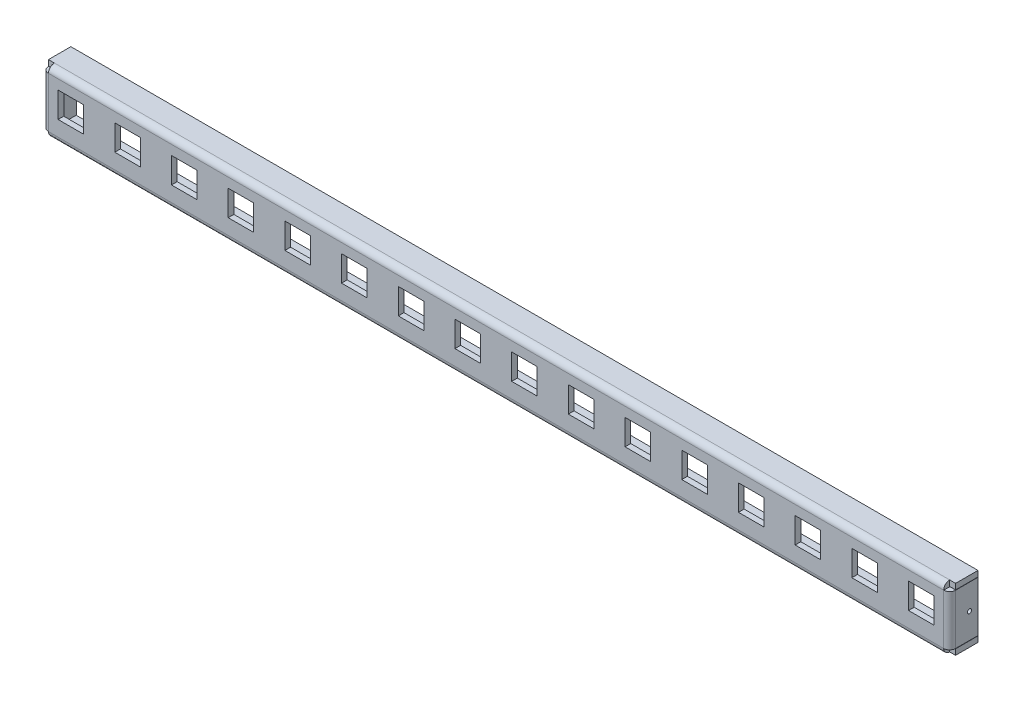
from build123d import *

# Parameters (mm, degrees)
SKETCH_1_W                         = 320
SKETCH_1_H                         = 22
SM_BASE_FLANGE_1_DEPTH             = 2
SM_EDGE_FLANGE_1_STRIP_W           = 8.2
SM_EDGE_FLANGE_1_STRIP_H           = 2
SM_EDGE_FLANGE_1_STRIP_CUT_DEPTH   = 320
SM_EDGE_FLANGE_1_STRIP_2_W         = 8.2
SM_EDGE_FLANGE_1_STRIP_2_H         = 2
SM_EDGE_FLANGE_1_STRIP_CUT_2_DEPTH = 320
SM_EDGE_FLANGE_1_DEPTH             = 320
SM_EDGE_FLANGE_1_BEND_DEPTH        = 320
SM_START                           = -11
SM_EDGE_FLANGE_2_DEPTH             = 22
SM_EDGE_FLANGE_2_2_DEPTH           = 2.1
SM_START_2                         = 8.9
SM_EDGE_FLANGE_2_3_DEPTH           = 2.1
SM_START_3                         = -8.9
SM_EDGE_FLANGE_2_4_DEPTH           = 17.8
SKETCH_18_W                        = 9
SKETCH_18_H                        = 9
CUT_EXTRUDE_1_DEPTH                = 10
PATTERN_LINEAR_1_COUNT             = 20
PATTERN_LINEAR_1_PITCH             = 20
CUT_EXTRUDE_2_DEPTH                = 321.345126387
CUT_EXTRUDE_2_DEPTH_BACK           = 321.345126387
SKETCH_19_R                        = 0.75


# Read off the part's stored shape, not the designer's step: 边线-法兰2
# Sheet-metal steps are written as plain solids
with BuildPart() as part:
    # Sketch 1 → 基体-法兰1 (new body)
    with BuildSketch(Plane.XY):
        Rectangle(SKETCH_1_W, SKETCH_1_H)
    extrude(amount=-SM_BASE_FLANGE_1_DEPTH)

    # 边线-法兰1 strip (across the edge) → 边线-法兰1 strip cut (cut)
    with BuildSketch(Plane(origin=(160, -11, -2), x_dir=(0, 1, 0), z_dir=(-1, 0, 0))):
        with Locations((-2, -1)):
            Rectangle(SM_EDGE_FLANGE_1_STRIP_W, SM_EDGE_FLANGE_1_STRIP_H)
    extrude(amount=SM_EDGE_FLANGE_1_STRIP_CUT_DEPTH, mode=Mode.SUBTRACT)

    # 边线-法兰1 strip 2 (across the edge) → 边线-法兰1 strip cut 2 (cut)
    with BuildSketch(Plane(origin=(-160, 11, -2), x_dir=(0, -1, 0), z_dir=(1, 0, 0))):
        with Locations((-2, -1)):
            Rectangle(SM_EDGE_FLANGE_1_STRIP_2_W, SM_EDGE_FLANGE_1_STRIP_2_H)
    extrude(amount=SM_EDGE_FLANGE_1_STRIP_CUT_2_DEPTH, mode=Mode.SUBTRACT)

    # 边线-法兰1 section (across the edge) → 边线-法兰1 (add)
    with BuildSketch(Plane(origin=(160, -11, -2), x_dir=(0, 1, 0), z_dir=(-1, 0, 0))):
        with BuildLine():
            Line((0, 0.1), (0, 8))
            Line((0, 8), (2, 8))
            Line((2, 8), (2, 0.1))
            ThreePointArc((2, 0.1), (2.029289322, 0.029289322), (2.1, 0))
            Line((2.1, 0), (2.1, -2))
            ThreePointArc((2.1, -2), (0.61507576, -1.38492424), (0, 0.1))
        make_face()
    extrude(amount=SM_EDGE_FLANGE_1_DEPTH)

    # 边线-法兰1 section 2 (across the edge) → 边线-法兰1 bend (add)
    with BuildSketch(Plane(origin=(-160, 11, -2), x_dir=(0, -1, 0), z_dir=(1, 0, 0))):
        with BuildLine():
            Line((0, 0.1), (0, 8))
            Line((0, 8), (2, 8))
            Line((2, 8), (2, 0.1))
            ThreePointArc((2, 0.1), (2.029289322, 0.029289322), (2.1, 0))
            Line((2.1, 0), (2.1, -2))
            ThreePointArc((2.1, -2), (0.61507576, -1.38492424), (0, 0.1))
        make_face()
    extrude(amount=SM_EDGE_FLANGE_1_BEND_DEPTH)

    # 边线-法兰2 outline → 边线-法兰2 (cut)
    with BuildSketch(Plane(origin=(0, 0, 0), x_dir=(1, 0, 0), z_dir=(0, 1, 0)).offset(SM_START)):
        with BuildLine():
            Line((158, 2.1), (157.9, 2.1))
            Line((157.9, 2.1), (157.9, 2))
            ThreePointArc((157.9, 2), (157.970710678, 2.029289322), (158, 2.1))
        make_face()
        with BuildLine():
            ThreePointArc((160, 2.1), (159.38492424, 0.61507576), (157.9, 0))
            Line((157.9, 0), (160, 0))
            Line((160, 0), (160, 2.1))
        make_face()
        with BuildLine():
            ThreePointArc((-158, 2.1), (-157.970710678, 2.029289322), (-157.9, 2))
            Line((-157.9, 2), (-157.9, 2.1))
            Line((-157.9, 2.1), (-158, 2.1))
        make_face()
        with BuildLine():
            Line((-160, 0), (-157.9, 0))
            ThreePointArc((-157.9, 0), (-159.38492424, 0.61507576), (-160, 2.1))
            Line((-160, 2.1), (-160, 0))
        make_face()
    extrude(amount=SM_EDGE_FLANGE_2_DEPTH, mode=Mode.SUBTRACT)

    # Sm Edge Flange 2 2 outline → Sm Edge Flange 2 2 (cut)
    with BuildSketch(Plane(origin=(0, 0, 0), x_dir=(1, 0, 0), z_dir=(0, 1, 0)).offset(SM_START)):
        with BuildLine():
            Line((160, 2.1), (158, 2.1))
            ThreePointArc((158, 2.1), (157.970710678, 2.029289322), (157.9, 2))
            Line((157.9, 2), (157.9, 0))
            ThreePointArc((157.9, 0), (159.38492424, 0.61507576), (160, 2.1))
        make_face()
        with BuildLine():
            ThreePointArc((-160, 2.1), (-159.38492424, 0.61507576), (-157.9, 0))
            Line((-157.9, 0), (-157.9, 2))
            ThreePointArc((-157.9, 2), (-157.970710678, 2.029289322), (-158, 2.1))
            Line((-158, 2.1), (-160, 2.1))
        make_face()
    extrude(amount=SM_EDGE_FLANGE_2_2_DEPTH, mode=Mode.SUBTRACT)

    # Sm Edge Flange 2 3 outline → Sm Edge Flange 2 3 (cut)
    with BuildSketch(Plane(origin=(0, 0, 0), x_dir=(1, 0, 0), z_dir=(0, 1, 0)).offset(SM_START_2)):
        with BuildLine():
            Line((160, 2.1), (158, 2.1))
            ThreePointArc((158, 2.1), (157.970710678, 2.029289322), (157.9, 2))
            Line((157.9, 2), (157.9, 0))
            ThreePointArc((157.9, 0), (159.38492424, 0.61507576), (160, 2.1))
        make_face()
        with BuildLine():
            ThreePointArc((-160, 2.1), (-159.38492424, 0.61507576), (-157.9, 0))
            Line((-157.9, 0), (-157.9, 2))
            ThreePointArc((-157.9, 2), (-157.970710678, 2.029289322), (-158, 2.1))
            Line((-158, 2.1), (-160, 2.1))
        make_face()
    extrude(amount=SM_EDGE_FLANGE_2_3_DEPTH, mode=Mode.SUBTRACT)

    # Sm Edge Flange 2 4 outline → Sm Edge Flange 2 4 (add)
    with BuildSketch(Plane(origin=(0, 0, 0), x_dir=(1, 0, 0), z_dir=(0, 1, 0)).offset(SM_START_3)):
        with BuildLine():
            Line((158, 10), (158, 2.1))
            ThreePointArc((158, 2.1), (157.970710678, 2.029289322), (157.9, 2))
            Line((157.9, 2), (159.997617696, 2))
            ThreePointArc((159.997617696, 2), (159.99940434, 2.049985814), (160, 2.1))
            Line((160, 2.1), (160, 10))
            Line((160, 10), (158, 10))
        make_face()
        with BuildLine():
            Line((-159.997617696, 2), (-157.9, 2))
            ThreePointArc((-157.9, 2), (-157.970710678, 2.029289322), (-158, 2.1))
            Line((-158, 2.1), (-158, 10))
            Line((-158, 10), (-160, 10))
            Line((-160, 10), (-160, 2.1))
            ThreePointArc((-160, 2.1), (-159.99940434, 2.049985814), (-159.997617696, 2))
        make_face()
    extrude(amount=SM_EDGE_FLANGE_2_4_DEPTH)

    # 草图18 → 切除-拉伸1 (cut)
    with BuildSketch(Plane.XY):
        with Locations((-150, 1)):
            Rectangle(SKETCH_18_W, SKETCH_18_H)
    cut_extrude_1 = extrude(amount=-CUT_EXTRUDE_1_DEPTH, mode=Mode.SUBTRACT)

    # 阵列(线性)1: 切除-拉伸1 ×20
    with Locations(*[(i * PATTERN_LINEAR_1_PITCH, 0, 0) for i in range(1, PATTERN_LINEAR_1_COUNT)]):
        add(cut_extrude_1, mode=Mode.SUBTRACT)

    # 草图19 → 切除-拉伸2 (cut, two sides: drawn at the far end of the back side and taken through both)
    with BuildSketch(Plane(origin=(160, 0, 0), x_dir=(0, 0, -1), z_dir=(1, 0, 0)).offset(-CUT_EXTRUDE_2_DEPTH_BACK)):
        with Locations(Location((7, 0, 0), (0, 0, 180))):
            Circle(SKETCH_19_R)
    extrude(amount=CUT_EXTRUDE_2_DEPTH + CUT_EXTRUDE_2_DEPTH_BACK, mode=Mode.SUBTRACT)


solid = part.part
